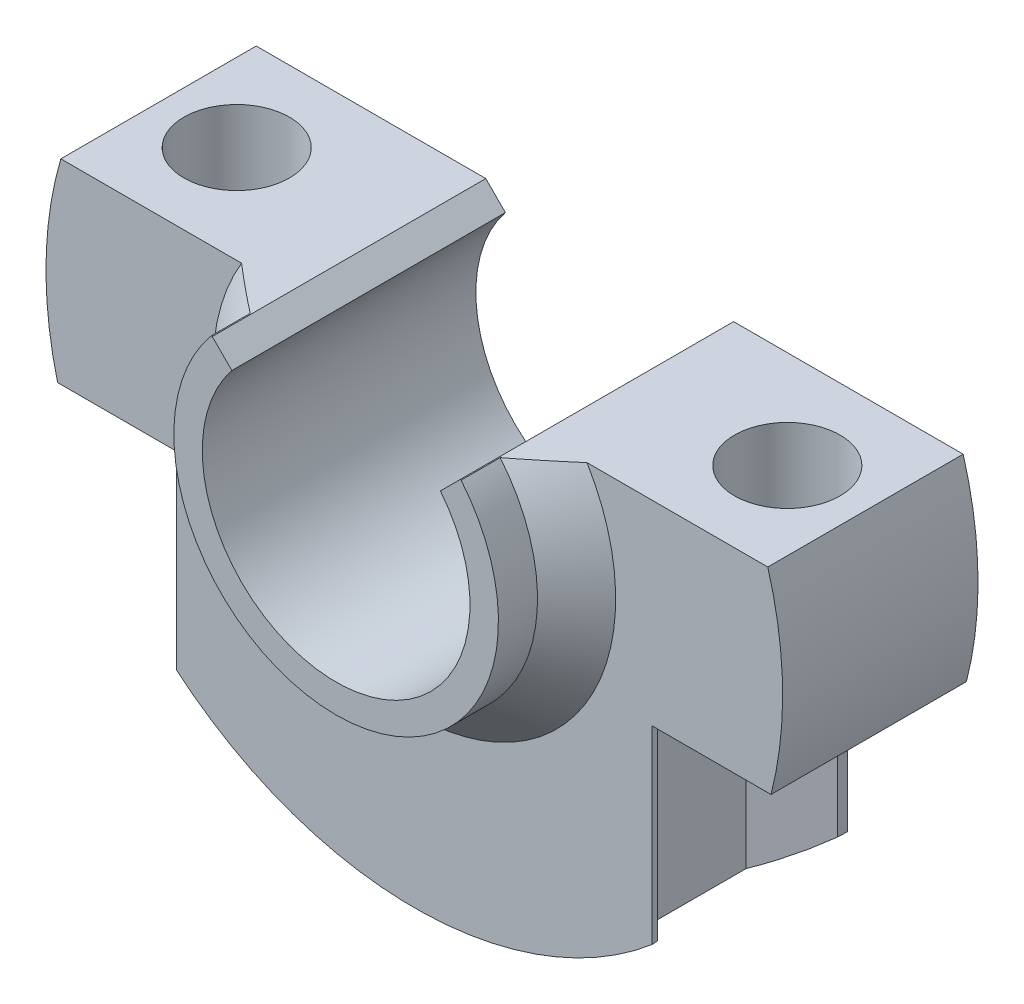
from build123d import *
from OCP.BRepFilletAPI import BRepFilletAPI_MakeChamfer

# Parameters (mm, degrees)
BOSS_EXTRUDE1_DEPTH    = 2.5
BOSS_EXTRUDE2_START    = 2
BOSS_EXTRUDE2_DEPTH    = 2
CHAMFER1_SIZE          = 1
CHAMFER2_SIZE          = 1
M2_5_CLEARANCE_HOLE1_D = 2.7
CUT_EXTRUDE1_DEPTH     = 7.074630657
CHAMFER3_SIZE          = 0.4
CHAMFER3_SIZE2         = 0.292820323
CHAMFER4_SIZE          = 0.4
CHAMFER4_SIZE2         = 0.292820323
CHAMFER5_SIZE          = 1


with BuildPart() as part:
    # Sketch1 → Boss-Extrude1 (new, symmetric)
    with BuildSketch(Plane.XY):
        with BuildLine():
            Line((9.044892613, 2.649630657), (2.170272421, 2.649630657))
            ThreePointArc((2.170272421, 2.649630657), (3.095465073, 1.465851622), (3.425, 0))
            ThreePointArc((3.425, 0), (-1.465851622, -3.095465073), (-2.170272421, 2.649630657))
            Line((-2.170272421, 2.649630657), (-9.044892613, 2.649630657))
            ThreePointArc((-9.044892613, 2.649630657), (0, -9.425), (9.044892613, 2.649630657))
        make_face()
    extrude(amount=BOSS_EXTRUDE1_DEPTH, both=True)

    # Sketch2 → Boss-Extrude2 (add)
    with BuildSketch(Plane.XY.offset(2.5).offset(BOSS_EXTRUDE2_START)):
        with BuildLine():
            ThreePointArc((4.1529, 0), (3.906839776, 1.408254726), (3.197817348, 2.649630657))
            Line((3.197817348, 2.649630657), (2.170272421, 2.649630657))
            ThreePointArc((2.170272421, 2.649630657), (0, -3.425), (-2.170272421, 2.649630657))
            Line((-2.170272421, 2.649630657), (-3.197817348, 2.649630657))
            ThreePointArc((-3.197817348, 2.649630657), (-1.408254726, -3.906839776), (4.1529, 0))
        make_face()
    extrude(amount=-BOSS_EXTRUDE2_DEPTH)

    # Chamfer1
    # the kernel refuses this chamfer: 1, 0.710595202 mm, written as the material it takes off along each edge
    with BuildSketch(Plane(origin=(-2.170272421, 2.649630657, -5.071682988), x_dir=(-1, 0, 0), z_dir=(0, 0, 1))) as chamfer1_piece_1:
        with BuildLine():
            Line((CHAMFER1_SIZE, 0), (0.497857743, 0.502142257))
            ThreePointArc((0.497857743, 0.502142257), (0.261983404, 0.238250015), (0, 0))
            Line((0, 0), (CHAMFER1_SIZE, 0))
        make_face()
    extrude(amount=12.143365976, mode=Mode.SUBTRACT)

    # Chamfer2
    # the kernel refuses this chamfer: 1, 0.710595202 mm, written as the material it takes off along each edge
    with BuildSketch(Plane(origin=(2.170272421, 2.649630657, -5.071682988), x_dir=(1, 0, 0), z_dir=(0, 0, 1))) as chamfer2_piece_1:
        with BuildLine():
            Line((CHAMFER2_SIZE, 0), (0.497857743, -0.502142257))
            ThreePointArc((0.497857743, -0.502142257), (0.261983404, -0.238250015), (0, 0))
            Line((0, 0), (CHAMFER2_SIZE, 0))
        make_face()
    extrude(amount=12.143365976, mode=Mode.SUBTRACT)

    # M2.5 Clearance Hole1 (through all)
    with Locations(Plane(origin=(0, 2.649630657, 0), x_dir=(1, 0, 0), z_dir=(0, 1, 0))):
        with Locations((-7.044892613, 0), (7.044892613, 0)):
            Hole(M2_5_CLEARANCE_HOLE1_D / 2)

    # Sketch5 → Cut-Extrude1 (cut)
    with BuildSketch(Plane(origin=(0, -9.425, 0), x_dir=(-1, 0, 0), z_dir=(0, -1, 0))):
        Polygon((-12.044892613, 2.886751346), (-12.044892613, -2.886751346), (-7.044892613, -2.886751346), (-9.544892613, -1.443375673), (-9.544892613, 1.443375673), (-7.044892613, 2.886751346), align=None)
        Polygon((-4.544892613, 1.443375673), (-7.044892613, 2.886751346), (-9.544892613, 1.443375673), (-9.544892613, -1.443375673), (-7.044892613, -2.886751346), (-4.544892613, -1.443375673), align=None)
        Polygon((4.544892613, -1.443375673), (7.044892613, -2.886751346), (9.544892613, -1.443375673), (9.544892613, 1.443375673), (7.044892613, 2.886751346), (4.544892613, 1.443375673), align=None)
        Polygon((12.044892613, -2.886751346), (7.044892613, -2.886751346), (9.544892613, -1.443375673), (9.544892613, 1.443375673), (7.044892613, 2.886751346), (12.044892613, 2.886751346), align=None)
    extrude(amount=-CUT_EXTRUDE1_DEPTH, mode=Mode.SUBTRACT)

    # Chamfer3: one chamfer whose edges measure the first distance from different faces: ONE call of the kernel's chamfer builder (chamfer() names one face for all edges)
    chamfer3_edges_1 = [part.edges().sort_by_distance(p)[0] for p in [
        (6.375019632, -4.646126535, 2.5),
    ]]
    chamfer3_side_1 = [part.faces().sort_by_distance(p)[0] for p in [
        (5.422316201, -5.016137367, 1.949956418),
    ]]
    chamfer3_edges_2 = [part.edges().sort_by_distance(p)[0] for p in [
        (-6.375019632, -4.646126535, 2.5),
    ]]
    chamfer3_side_2 = [part.faces().sort_by_distance(p)[0] for p in [
        (-5.422316201, -5.016137367, 1.949956418),
    ]]
    chamfer3 = BRepFilletAPI_MakeChamfer(part.part.solid().wrapped)
    for e in chamfer3_edges_1:
        chamfer3.Add(CHAMFER3_SIZE, CHAMFER3_SIZE2, e.wrapped, chamfer3_side_1[0].wrapped)  # the first distance lies on this face
    for e in chamfer3_edges_2:
        chamfer3.Add(CHAMFER3_SIZE, CHAMFER3_SIZE2, e.wrapped, chamfer3_side_2[0].wrapped)  # the first distance lies on this face
    add(Compound.cast(chamfer3.Shape()), mode=Mode.REPLACE)

    # Chamfer4: one chamfer whose edges measure the first distance from different faces: ONE call of the kernel's chamfer builder (chamfer() names one face for all edges)
    chamfer4_edges_1 = [part.edges().sort_by_distance(p)[0] for p in [
        (6.375019632, -4.646126535, -2.5),
    ]]
    chamfer4_side_1 = [part.faces().sort_by_distance(p)[0] for p in [
        (5.422316201, -5.016137367, -1.949956418),
    ]]
    chamfer4_edges_2 = [part.edges().sort_by_distance(p)[0] for p in [
        (-6.375019632, -4.646126535, -2.5),
    ]]
    chamfer4_side_2 = [part.faces().sort_by_distance(p)[0] for p in [
        (-5.422316201, -5.016137367, -1.949956418),
    ]]
    chamfer4 = BRepFilletAPI_MakeChamfer(part.part.solid().wrapped)
    for e in chamfer4_edges_1:
        chamfer4.Add(CHAMFER4_SIZE, CHAMFER4_SIZE2, e.wrapped, chamfer4_side_1[0].wrapped)  # the first distance lies on this face
    for e in chamfer4_edges_2:
        chamfer4.Add(CHAMFER4_SIZE, CHAMFER4_SIZE2, e.wrapped, chamfer4_side_2[0].wrapped)  # the first distance lies on this face
    add(Compound.cast(chamfer4.Shape()), mode=Mode.REPLACE)

    # Chamfer5
    chamfer5_edges = [part.edges().sort_by_distance(p)[0] for p in [
        (-1.408254726, -3.906839776, 2.5),
    ]]
    chamfer(chamfer5_edges, length=CHAMFER5_SIZE)


solid = part.part
